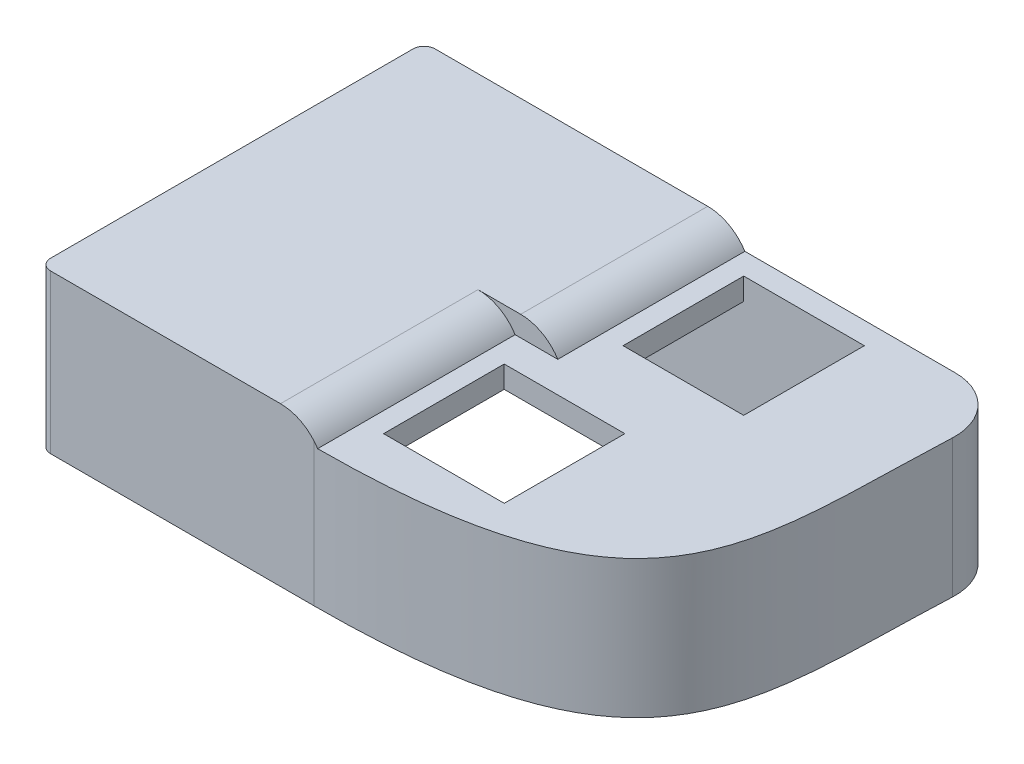
from build123d import *

# Parameters (mm, degrees)
BUTTONHEIGHTADJUSTMENT_DEPTH          = 13.2715
DUPONTCONNECTORHEIGHTADJUSTMENT_DEPTH = 2.4892
ADDINGTOPTHICKNESS_DUPONT_DEPTH       = 2.54
ADDINGTOPTHICKNESS_BUTTON_DEPTH       = 2.667
SHELL1_START                          = 48.176932074
SHELL1_DEPTH                          = 13.3985
SHELL1_START_2                        = 61.575432074
SHELL1_2_DEPTH                        = 2.3622
BUTTONOPENINGS_DEPTH                  = 105.849340515
BUTTONOPENINGS_DEPTH_BACK             = 105.849340515
SKETCH4_W                             = 13.944930934
SKETCH4_H                             = 13.944930934
SKETCH4_W_2                           = 13.944930933
FILLET1_R                             = 5.08
FILLET2_R                             = 5.08
FILLET3_R                             = 1.905
BOSS_EXTRUDE5_REACH                   = 107.234
SKETCH7_R                             = 5
SKETCH7_3_R                           = 2.413
CUT_EXTRUDE2_DEPTH                    = 6.35
SKETCH8_R                             = 1.4986
CUT_EXTRUDE3_DEPTH                    = 9.4107
SKETCH8_3_R                           = 1.4986
CUT_EXTRUDE4_DEPTH                    = 7.0485


# Read off the part's stored shape, not the designer's step: Shell1
with BuildPart() as part:
    # Sketch1 → ButtonHeightAdjustment (new body)
    with BuildSketch(Plane(origin=(0, 48.176932074, 0), x_dir=(1, 0, 0), z_dir=(0, 1, 0))):
        with BuildLine():
            Line((7.699380634, -27.856075324), (7.699380634, -69.766075324))
            ThreePointArc((7.699380634, -69.766075324), (8.071355022, -70.664100937), (8.969380634, -71.036075324))
            Line((8.969380634, -71.036075324), (39.449380634, -71.036075324))
            add(Edge.make_bspline(
                [(39.449380634, -71.036075324), (78.302087084, -71.036075324), (74.39537319, -55.792900821), (75.446576955, -33.231621959)],
                knots=[0.087040061, 0.087040061, 0.087040061, 0.087040061, 1, 1, 1, 1], degree=3))
            ThreePointArc((75.446576955, -33.231621959), (73.696889706, -28.551683755), (69.103458465, -26.586075324))
            Line((69.103458465, -26.586075324), (8.969380634, -26.586075324))
            ThreePointArc((8.969380634, -26.586075324), (8.071355022, -26.958049712), (7.699380634, -27.856075324))
        make_face()
    extrude(amount=BUTTONHEIGHTADJUSTMENT_DEPTH)

    # Sketch2 → DupontConnectorHeightAdjustment (add)
    with BuildSketch(Plane(origin=(0, 61.448432074, 0), x_dir=(1, 0, 0), z_dir=(0, 1, 0))):
        with BuildLine():
            add(Edge.make_bspline(
                [(39.449380634, -71.036075324), (39.581316275, -71.036075324), (39.712758839, -71.035899549), (39.843710197, -71.03554831)],
                knots=[0.087040061, 0.087040061, 0.087040061, 0.087040061, 0.090140281, 0.090140281, 0.090140281, 0.090140281], degree=3))
            Line((39.843710197, -71.03554831), (39.843710197, -48.207398996))
            Line((39.843710197, -48.207398996), (44.776624411, -48.207398996))
            Line((44.776624411, -48.207398996), (44.776624411, -26.586075324))
            Line((44.776624411, -26.586075324), (8.969380634, -26.586075324))
            ThreePointArc((8.969380634, -26.586075324), (8.071355022, -26.958049712), (7.699380634, -27.856075324))
            Line((7.699380634, -27.856075324), (7.699380634, -69.766075324))
            ThreePointArc((7.699380634, -69.766075324), (8.071355022, -70.664100937), (8.969380634, -71.036075324))
            Line((8.969380634, -71.036075324), (39.449380634, -71.036075324))
        make_face()
    extrude(amount=DUPONTCONNECTORHEIGHTADJUSTMENT_DEPTH)

    # Sketch3 → AddingTopThickness_Dupont (add)
    with BuildSketch(Plane(origin=(0, 63.937632074, 0), x_dir=(1, 0, 0), z_dir=(0, 1, 0))):
        with BuildLine():
            Line((39.843710197, -48.207398996), (44.776624411, -48.207398996))
            Line((44.776624411, -48.207398996), (44.776624411, -26.586075324))
            Line((44.776624411, -26.586075324), (8.969380634, -26.586075324))
            ThreePointArc((8.969380634, -26.586075324), (8.071355022, -26.958049712), (7.699380634, -27.856075324))
            Line((7.699380634, -27.856075324), (7.699380634, -69.766075324))
            ThreePointArc((7.699380634, -69.766075324), (8.071355022, -70.664100937), (8.969380634, -71.036075324))
            Line((8.969380634, -71.036075324), (39.449380634, -71.036075324))
            add(Edge.make_bspline(
                [(39.449380634, -71.036075324), (39.581316276, -71.036075324), (39.712758842, -71.035899549), (39.8437102, -71.03554831)],
                knots=[0.087040061, 0.087040061, 0.087040061, 0.087040061, 0.090140281, 0.090140281, 0.090140281, 0.090140281], degree=3))
            Line((39.8437102, -71.03554831), (39.843710197, -48.207398996))
        make_face()
    extrude(amount=ADDINGTOPTHICKNESS_DUPONT_DEPTH)

    # Sketch5 → AddingTopThickness_Button (add)
    with BuildSketch(Plane(origin=(0, 61.448432074, 0), x_dir=(1, 0, 0), z_dir=(0, 1, 0))):
        with BuildLine():
            Line((39.843710197, -48.207398996), (39.8437102, -71.03554831))
            add(Edge.make_bspline(
                [(39.8437102, -71.03554831), (78.275611493, -70.93246569), (74.398942858, -55.71628745), (75.446576955, -33.231621959)],
                knots=[0.090140281, 0.090140281, 0.090140281, 0.090140281, 1, 1, 1, 1], degree=3))
            ThreePointArc((75.446576955, -33.231621959), (73.696889706, -28.551683755), (69.103458465, -26.586075324))
            Line((69.103458465, -26.586075324), (44.776624411, -26.586075324))
            Line((44.776624411, -26.586075324), (44.776624411, -48.207398996))
            Line((44.776624411, -48.207398996), (39.843710197, -48.207398996))
        make_face()
    extrude(amount=ADDINGTOPTHICKNESS_BUTTON_DEPTH)

    # Shell1 outline → Shell1 (cut)
    with BuildSketch(Plane(origin=(0, 0, 0), x_dir=(1, 0, 0), z_dir=(0, 1, 0)).offset(SHELL1_START)):
        with BuildLine():
            add(Edge.make_bspline(
                [(39.449379827, -68.496075324), (39.449586547, -68.496075324), (39.449791514, -68.496075324), (39.449995043, -68.496075324), (39.450199135, -68.496075323), (39.450405991, -68.496075321), (39.450613287, -68.49607532), (39.450814961, -68.496075318), (39.45101783, -68.496075316), (39.451228774, -68.496075313), (39.451429783, -68.49607531), (39.451635772, -68.496075307), (39.452137481, -68.496075299), (39.452434182, -68.496075293), (39.452730881, -68.496075287), (39.453027578, -68.49607528), (39.453324273, -68.496075272), (39.453620966, -68.496075264), (39.453917657, -68.496075255), (39.454214347, -68.496075245), (39.454511034, -68.496075235), (39.454807719, -68.496075224), (39.455104403, -68.496075212), (39.455994447, -68.496075176), (39.456587802, -68.496075149), (39.45718115, -68.496075119), (39.45777449, -68.496075087), (39.458367822, -68.496075051), (39.458961146, -68.496075014), (39.459554462, -68.496074974), (39.460147771, -68.496074931), (39.460741072, -68.496074885), (39.461334366, -68.496074837), (39.461927651, -68.496074786), (39.463707485, -68.496074626), (39.46489401, -68.496074509), (39.466080504, -68.496074381), (39.467266967, -68.496074242), (39.468453399, -68.496074094), (39.4696398, -68.496073934), (39.47082617, -68.496073764), (39.472012509, -68.496073584), (39.473198817, -68.496073393), (39.474385095, -68.496073191), (39.475571341, -68.496072979), (39.479129987, -68.496072311), (39.481502294, -68.496071824), (39.483874478, -68.496071295), (39.486246537, -68.496070723), (39.488618473, -68.49607011), (39.490990286, -68.496069454), (39.493361974, -68.496068756), (39.495733539, -68.496068017), (39.49810498, -68.496067235), (39.500476297, -68.496066411), (39.50284749, -68.496065545), (39.514702839, -68.496061004), (39.524185139, -68.496056698), (39.53366546, -68.496051718), (39.543143801, -68.496046066), (39.552620163, -68.49603974), (39.562094547, -68.496032741), (39.571566952, -68.496025069), (39.581037379, -68.496016724), (39.590505827, -68.496007706), (39.599972298, -68.495998014), (39.609436791, -68.49598765), (39.656749367, -68.495932466), (39.694567786, -68.495877552), (39.732354575, -68.495811875), (39.770109747, -68.495735439), (39.807833313, -68.495648246), (39.845525286, -68.495550299), (39.883185678, -68.495441603), (39.9208145, -68.495322159), (39.958411766, -68.495191972), (39.995977486, -68.495051044), (40.033511673, -68.494899378), (40.146019672, -68.494412178), (40.22089892, -68.49404444), (40.295652182, -68.49363379), (40.370279553, -68.493180254), (40.444781129, -68.492683856), (40.519157007, -68.492144625), (40.593407283, -68.491562584), (40.667532053, -68.49093776), (40.741531414, -68.490270178), (40.815405462, -68.489559865), (40.889154293, -68.488806846), (41.257272849, -68.484828347), (41.549765836, -68.480962528), (41.840263075, -68.476415439), (42.128770675, -68.471188833), (42.415294743, -68.46528446), (42.699841389, -68.458704073), (42.982416721, -68.451449422), (43.263026848, -68.443522258), (43.541677878, -68.434924334), (43.81837592, -68.425657399), (44.093127082, -68.415723207), (44.911558257, -68.383924109), (45.449415797, -68.360063452), (45.979558488, -68.333556107), (46.502034658, -68.304417105), (47.016892561, -68.272661946), (47.524180382, -68.238306591), (48.023946236, -68.201367465), (48.516238167, -68.161861458), (49.001104147, -68.119805924), (49.478592082, -68.075218681), (49.948749802, -68.028118011), (51.337375611, -67.879331956), (52.233996985, -67.770162893), (53.10187272, -67.65116783), (53.941387356, -67.522507203), (54.752927499, -67.384351455), (55.536883515, -67.23688237), (56.29365187, -67.080293824), (57.023638097, -66.914791937), (57.72726042, -66.740594643), (58.404954001, -66.557930666), (59.057175843, -66.367037906), (60.938879277, -65.770407902), (62.093404567, -65.34071881), (63.151826299, -64.881036106), (64.118529707, -64.39342752), (64.99834488, -63.879851847), (65.796921512, -63.342095032), (66.520883858, -62.781316869), (67.177505422, -62.197416382), (67.77398037, -61.588740771), (68.316609285, -60.952528366), (68.810360599, -60.285890342), (70.157226589, -58.18651634), (70.875939498, -56.654313157), (71.447642543, -54.967962519), (71.889256902, -53.108637628), (72.201031894, -51.080028633), (72.410024806, -48.90317794), (72.536553408, -46.578549842), (72.608216265, -44.123137631), (72.652402144, -41.540781475), (72.697717647, -38.840812898), (72.773461503, -36.029447938), (72.909329559, -33.113403305)],
                knots=[0.087040061, 0.087040061, 0.087040061, 0.087040061, 0.087040061, 0.087040061, 0.087040061, 0.087040061, 0.087040061, 0.087040061, 0.087040061, 0.087040061, 0.087040061, 0.087059666, 0.087059666, 0.087059666, 0.087059666, 0.087059666, 0.087059666, 0.087059666, 0.087059666, 0.087059666, 0.087059666, 0.087059666, 0.08708804, 0.08708804, 0.08708804, 0.08708804, 0.08708804, 0.08708804, 0.08708804, 0.08708804, 0.08708804, 0.08708804, 0.08708804, 0.087144789, 0.087144789, 0.087144789, 0.087144789, 0.087144789, 0.087144789, 0.087144789, 0.087144789, 0.087144789, 0.087144789, 0.087144789, 0.087258286, 0.087258286, 0.087258286, 0.087258286, 0.087258286, 0.087258286, 0.087258286, 0.087258286, 0.087258286, 0.087258286, 0.087258286, 0.087485279, 0.087485279, 0.087485279, 0.087485279, 0.087485279, 0.087485279, 0.087485279, 0.087485279, 0.087485279, 0.087485279, 0.087485279, 0.088393254, 0.088393254, 0.088393254, 0.088393254, 0.088393254, 0.088393254, 0.088393254, 0.088393254, 0.088393254, 0.088393254, 0.088393254, 0.092025154, 0.092025154, 0.092025154, 0.092025154, 0.092025154, 0.092025154, 0.092025154, 0.092025154, 0.092025154, 0.092025154, 0.092025154, 0.099288952, 0.099288952, 0.099288952, 0.099288952, 0.099288952, 0.099288952, 0.099288952, 0.099288952, 0.099288952, 0.099288952, 0.099288952, 0.128344147, 0.128344147, 0.128344147, 0.128344147, 0.128344147, 0.128344147, 0.128344147, 0.128344147, 0.128344147, 0.128344147, 0.128344147, 0.186454538, 0.186454538, 0.186454538, 0.186454538, 0.186454538, 0.186454538, 0.186454538, 0.186454538, 0.186454538, 0.186454538, 0.186454538, 0.302675318, 0.302675318, 0.302675318, 0.302675318, 0.302675318, 0.302675318, 0.302675318, 0.302675318, 0.302675318, 0.302675318, 0.302675318, 0.535116879, 0.535116879, 0.535116879, 0.535116879, 0.535116879, 0.535116879, 0.535116879, 0.535116879, 0.535116879, 0.535116879, 0.535116879, 1, 1, 1, 1, 1, 1, 1, 1, 1, 1, 1, 1, 1], degree=12))
            ThreePointArc((72.909329559, -33.113403305), (71.859517209, -30.305440383), (69.103458465, -29.126075324))
            Line((69.103458465, -29.126075324), (10.239380634, -29.126075324))
            Line((10.239380634, -29.126075324), (10.239380634, -68.496075324))
            Line((10.239380634, -68.496075324), (39.449379827, -68.496075324))
        make_face()
    extrude(amount=SHELL1_DEPTH, mode=Mode.SUBTRACT)

    # Shell1 2 outline → Shell1 2 (cut)
    with BuildSketch(Plane(origin=(0, 0, 0), x_dir=(1, 0, 0), z_dir=(0, 1, 0)).offset(SHELL1_START_2)):
        Polygon((10.239380634, -68.496075324), (37.303710197, -68.496075324), (37.303710197, -45.667398996), (42.236624411, -45.667398996), (42.236624411, -29.126075324), (10.239380634, -29.126075324), align=None)
    extrude(amount=SHELL1_2_DEPTH, mode=Mode.SUBTRACT)

    # Sketch4 → ButtonOpenings (cut, two sides: drawn at the far end of the back side and taken through both)
    with BuildSketch(Plane(origin=(0, 64.115432074, 0), x_dir=(1, 0, 0), z_dir=(0, 1, 0)).offset(-BUTTONOPENINGS_DEPTH_BACK)):
        with Locations((54.157415047, -36.098540791)):
            Rectangle(SKETCH4_W, SKETCH4_H)
        with Locations((49.121503178, -58.744823399)):
            Rectangle(SKETCH4_W_2, SKETCH4_H)
    extrude(amount=BUTTONOPENINGS_DEPTH + BUTTONOPENINGS_DEPTH_BACK, mode=Mode.SUBTRACT)

    # Fillet1
    # the kernel refuses this fillet: 5.08 mm, written as the material it takes off along each edge
    with BuildSketch(Plane(origin=(39.843710202, 66.477632074, 81.765169447), x_dir=(0, -1, 0), z_dir=(-1.4390201579738435e-10, 0, -1.0))) as fillet1_piece_1:
        with BuildLine():
            CenterArc((5.08, 4.291848455), FILLET1_R, 180, 57.656088587)
            Line((0, 4.291848455), (-0.1016, 4.291848455))
            Line((-0.1016, 4.291848455), (-0.1016, 0))
            Line((-0.1016, 0), (0, -0.1016))
            ThreePointArc((0, -0.1016), (1.1811, -0.1016), (2.307844, -0.085836969))
            Line((2.307844, -0.085836969), (2.3622, 0))
        make_face()
    extrude(amount=33.557770451, mode=Mode.SUBTRACT)

    # Fillet2
    # the kernel refuses this fillet: 5.08 mm, written as the material it takes off along each edge
    with BuildSketch(Plane(origin=(44.776624411, 66.477632074, 58.937020134), x_dir=(-1, 0, 0), z_dir=(0, 0, -1))) as fillet2_piece_1:
        with BuildLine():
            CenterArc((4.291848455, -5.08), FILLET2_R, 90, 57.656088587)
            Line((0, -2.3622), (-0.085836969, -2.307844))
            ThreePointArc((-0.085836969, -2.307844), (-0.1016, -1.1811), (-0.1016, 0))
            Line((-0.1016, 0), (0, 0.1016))
            Line((0, 0.1016), (4.291848455, 0.1016))
            Line((4.291848455, 0.1016), (4.291848455, 0))
        make_face()
    extrude(amount=43.080565947, mode=Mode.SUBTRACT)

    # Fillet3
    fillet3_edges = [part.edges().sort_by_distance(p)[0] for p in [
        (37.303710197, 61.575432074, 57.08173716),
        (42.236624411, 61.575432074, 37.39673716),
    ]]
    fillet(fillet3_edges, radius=FILLET3_R)

    # Sketch7 → Boss-Extrude5 (add, up to next)
    with BuildSketch(Plane.XZ.offset(-48.176932074), mode=Mode.PRIVATE) as boss_extrude5_sk1:
        with Locations((12.870767082, 31.757461772)):
            Circle(SKETCH7_R)
    boss_extrude5_tool1 = extrude(boss_extrude5_sk1.sketch, amount=-BOSS_EXTRUDE5_REACH, mode=Mode.PRIVATE) - part.part
    # Sketch7 → Boss-Extrude5 (add, up to next)
    with BuildSketch(Plane.XZ.offset(-48.176932074), mode=Mode.PRIVATE) as boss_extrude5_sk2:
        with Locations((68.132943539, 49.074850698)):
            Circle(SKETCH7_R)
    boss_extrude5_tool2 = extrude(boss_extrude5_sk2.sketch, amount=-BOSS_EXTRUDE5_REACH, mode=Mode.PRIVATE) - part.part
    add(boss_extrude5_tool1.solids().sort_by_distance((12.870767, 48.176932, 31.757462))[0])
    add(boss_extrude5_tool2.solids().sort_by_distance((68.132944, 48.176932, 49.074851))[0])

    # Sketch7<3> → Cut-Extrude2 (cut)
    with BuildSketch(Plane.XZ.offset(-48.176932074)):
        with Locations(Location((12.870767082, 31.757461772, 0), (0, 0, 270))):
            Circle(SKETCH7_3_R)
        with Locations(Location((68.132943539, 49.074850698, 0), (0, 0, 270))):
            Circle(SKETCH7_3_R)
    extrude(amount=-CUT_EXTRUDE2_DEPTH, mode=Mode.SUBTRACT)

    # Sketch8 → Cut-Extrude3 (cut)
    with BuildSketch(Plane.XZ.offset(-54.526932074)):
        with Locations(Location((12.870767082, 31.757461772, 0), (0, 0, 270))):
            Circle(SKETCH8_R)
    extrude(amount=-CUT_EXTRUDE3_DEPTH, mode=Mode.SUBTRACT)

    # Sketch8<3> → Cut-Extrude4 (cut)
    with BuildSketch(Plane.XZ.offset(-54.526932074)):
        with Locations(Location((68.132943539, 49.074850698, 0), (0, 0, 270))):
            Circle(SKETCH8_3_R)
    extrude(amount=-CUT_EXTRUDE4_DEPTH, mode=Mode.SUBTRACT)

    # Sketch10 → Cut-Revolve1 (revolve, cut)
    with BuildSketch(Plane(origin=(68.132943539, 0, 0), x_dir=(0, -1, 0), z_dir=(-1, 0, 0)), mode=Mode.PRIVATE) as cut_revolve1_sk:
        Polygon((-54.526932074, 50.75517437), (-48.176932074, 51.874850698), (-48.176932074, 49.074850698), (-54.526932074, 49.074850698), align=None)
    revolve(cut_revolve1_sk.sketch.rotate(Axis((68.132943539, 54.526932074, 49.074850698), (0, -1, 0)), 180), axis=Axis((68.132943539, 54.526932074, 49.074850698), (0, -1, 0)), mode=Mode.SUBTRACT)

    # Sketch11 → Cut-Revolve2 (revolve, cut)
    with BuildSketch(Plane(origin=(12.870767082, 0, 0), x_dir=(0, -1, 0), z_dir=(-1, 0, 0)), mode=Mode.PRIVATE) as cut_revolve2_sk:
        Polygon((-54.526932074, 33.437785445), (-48.176932074, 34.557461772), (-48.176932074, 31.757461772), (-54.526932074, 31.757461772), align=None)
    revolve(cut_revolve2_sk.sketch.rotate(Axis((12.870767082, 54.526932074, 31.757461772), (0, -1, 0)), 180), axis=Axis((12.870767082, 54.526932074, 31.757461772), (0, -1, 0)), mode=Mode.SUBTRACT)


solid = part.part
